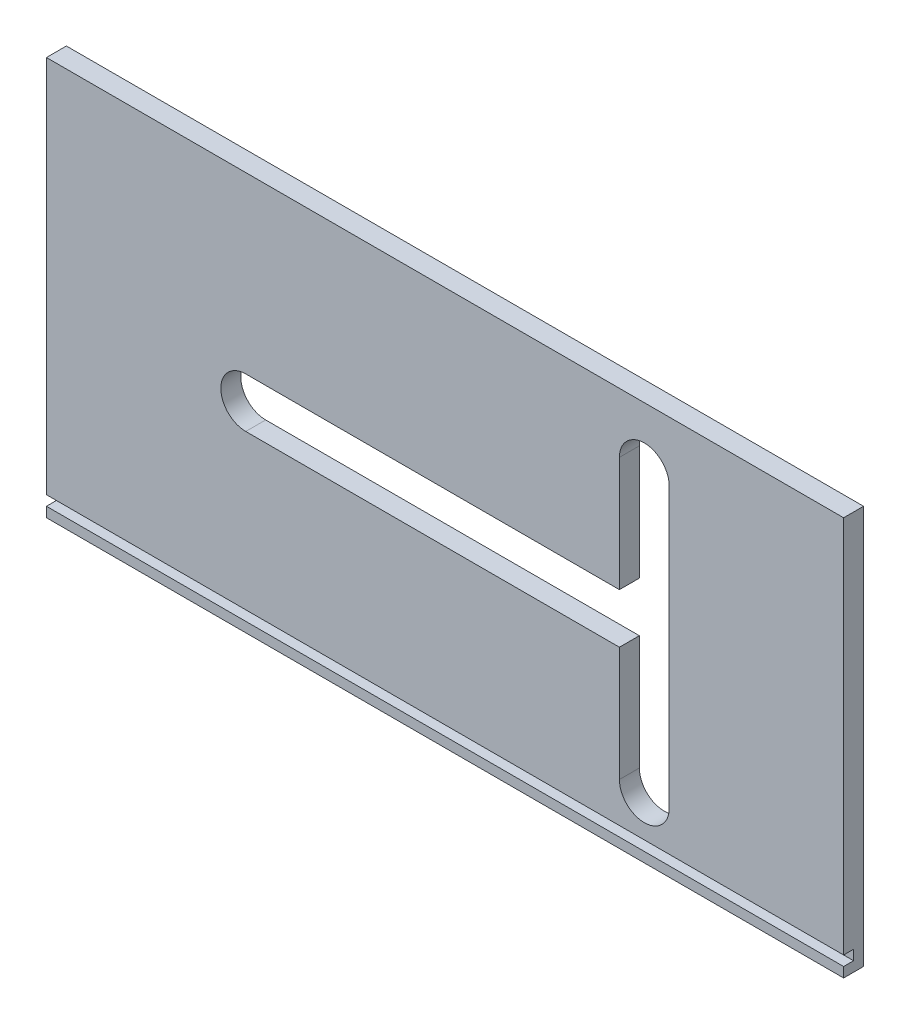
from build123d import *

# Parameters (mm, degrees)
SKETCH_1_W          = 400
SKETCH_1_H          = 200
EXTRUDE_1_DEPTH     = 10
SKETCH_2_W          = 400
SKETCH_2_H          = 5
CUT_EXTRUDE_1_DEPTH = 5
CUT_EXTRUDE_2_DEPTH = 369.18499218


with BuildPart() as part:
    # ｽｹｯﾁ1 → ﾎﾞｽ - 押し出し1 (new body)
    with BuildSketch(Plane.XY):
        with Locations((130.719868277, 61.507142857)):
            Rectangle(SKETCH_1_W, SKETCH_1_H)
    extrude(amount=EXTRUDE_1_DEPTH)

    # ｽｹｯﾁ2 → ｶｯﾄ - 押し出し1 (cut)
    with BuildSketch(Plane.XY.offset(10)):
        with Locations((130.719868277, -30.992857143)):
            Rectangle(SKETCH_2_W, SKETCH_2_H)
    extrude(amount=-CUT_EXTRUDE_1_DEPTH, mode=Mode.SUBTRACT)

    # ｽｹｯﾁ3 → ｶｯﾄ - 押し出し2 (cut, through all)
    with BuildSketch(Plane.XY.offset(10)):
        with BuildLine():
            Line((30.719868277, 74.007142857), (218.219868277, 74.007142857))
            Line((218.219868277, 74.007142857), (218.219868277, 131.507142857))
            ThreePointArc((218.219868277, 131.507142857), (230.719868277, 144.007142857), (243.219868277, 131.507142857))
            Line((243.219868277, 131.507142857), (243.219868277, -8.492857143))
            ThreePointArc((243.219868277, -8.492857143), (230.719868277, -20.992857143), (218.219868277, -8.492857143))
            Line((218.219868277, -8.492857143), (218.219868277, 49.007142857))
            Line((218.219868277, 49.007142857), (30.719868277, 49.007142857))
            ThreePointArc((30.719868277, 49.007142857), (18.219868277, 61.507142857), (30.719868277, 74.007142857))
        make_face()
    extrude(amount=-CUT_EXTRUDE_2_DEPTH, mode=Mode.SUBTRACT)


solid = part.part
